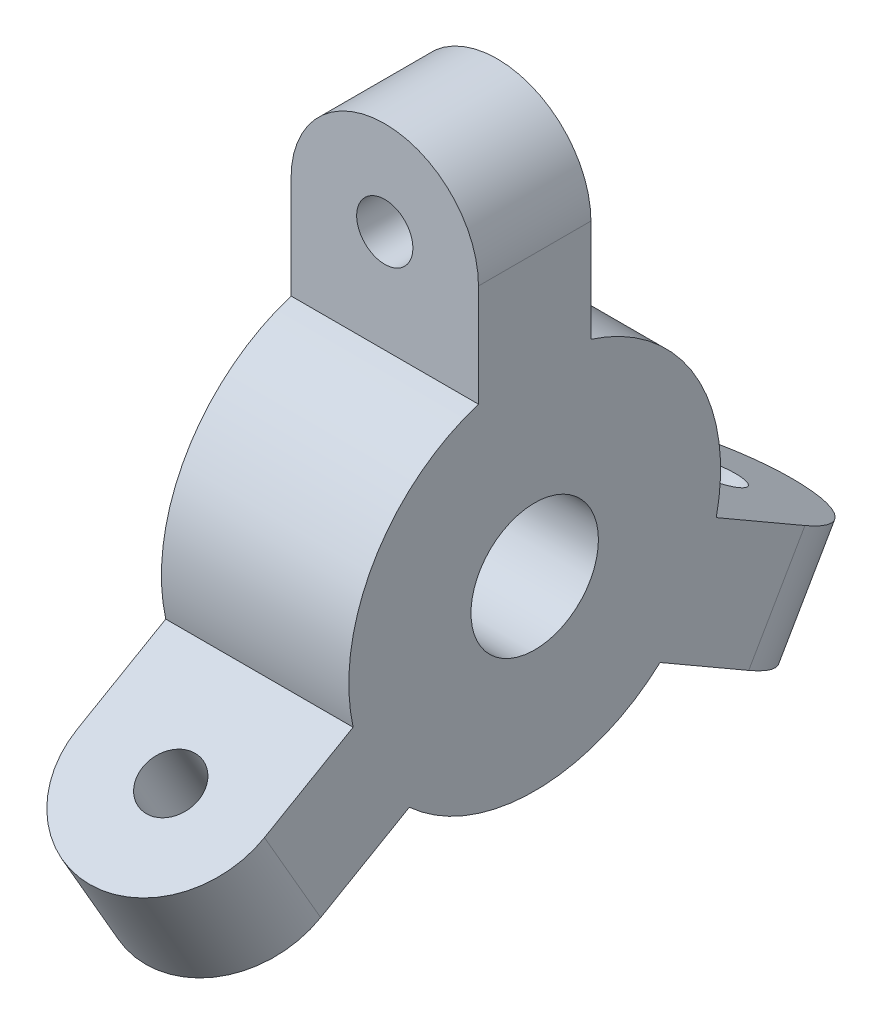
from build123d import *

# Parameters (mm, degrees)
BOSS_EXTRU_1_DEPTH           = 5
BOSS_EXTRU_1_DEPTH_BACK      = 5
TROU_TARAUD_M81_D            = 6.8
ESQUISSE5_R                  = 1.5
ENL_V_MAT_EXTRU_1_DEPTH      = 30.915250866
R_P_TITION_CIRCULAIRE1_COUNT = 3


with BuildPart() as part:
    # Esquisse1 → Boss.-Extru.1 (new, two sides: drawn at the far end of the back side and taken through both)
    with BuildSketch(Plane(origin=(0, 0, 0), x_dir=(0, 0, -1), z_dir=(1, 0, 0)).offset(-BOSS_EXTRU_1_DEPTH_BACK)):
        with BuildLine():
            Line((-3, 19.92), (3, 19.92))
            Line((3, 19.92), (3, 9.455495756))
            ThreePointArc((3, 9.455495756), (8.590972006, 4.96), (9.68869953, -2.129671667))
            Line((9.68869953, -2.129671667), (18.751226043, -7.361923789))
            Line((18.751226043, -7.361923789), (15.751226043, -12.558076211))
            Line((15.751226043, -12.558076211), (6.68869953, -7.32582409))
            ThreePointArc((6.68869953, -7.32582409), (0, -9.92), (-6.68869953, -7.32582409))
            Line((-6.68869953, -7.32582409), (-15.751226043, -12.558076211))
            Line((-15.751226043, -12.558076211), (-18.751226043, -7.361923789))
            Line((-18.751226043, -7.361923789), (-9.68869953, -2.129671667))
            ThreePointArc((-9.68869953, -2.129671667), (-8.590972006, 4.96), (-3, 9.455495756))
            Line((-3, 9.455495756), (-3, 19.92))
        make_face()
    extrude(amount=BOSS_EXTRU_1_DEPTH + BOSS_EXTRU_1_DEPTH_BACK)

    # Trou taraudé M81 (through all)
    with Locations(Plane(origin=(5, 0, 0), x_dir=(0, 0, -1), z_dir=(1, 0, 0))):
        with Locations((0, 0)):
            Hole(TROU_TARAUD_M81_D / 2)

    # Esquisse5 → Enlèv. mat.-Extru.1 (cut, through all)
    with BuildSketch(Plane.XY.offset(3)):
        with Locations((0, 14.92)):
            Circle(ESQUISSE5_R)
        with BuildLine():
            Line((-5, 9.455495756), (-5, 14.92))
            ThreePointArc((-5, 14.92), (0, 19.92), (5, 14.92))
            Line((5, 14.92), (5, 9.455495756))
            Line((5, 9.455495756), (13.62028311, 9.455495756))
            Line((13.62028311, 9.455495756), (13.62028311, 24.267392192))
            Line((13.62028311, 24.267392192), (-13.199246966, 24.267392192))
            Line((-13.199246966, 24.267392192), (-13.199246966, 9.455495756))
            Line((-13.199246966, 9.455495756), (-5, 9.455495756))
        make_face()
    enl_v_mat_extru_1 = extrude(amount=-ENL_V_MAT_EXTRU_1_DEPTH, mode=Mode.SUBTRACT)

    # Répétition circulaire1: Enlèv. mat.-Extru.1 ×3 about axis
    r_p_tition_circulaire1_axis = Axis((5, 0, 0), (1, 0, 0))
    for i in range(1, R_P_TITION_CIRCULAIRE1_COUNT):
        add(enl_v_mat_extru_1.rotate(r_p_tition_circulaire1_axis, i * 360 / R_P_TITION_CIRCULAIRE1_COUNT), mode=Mode.SUBTRACT)


solid = part.part
